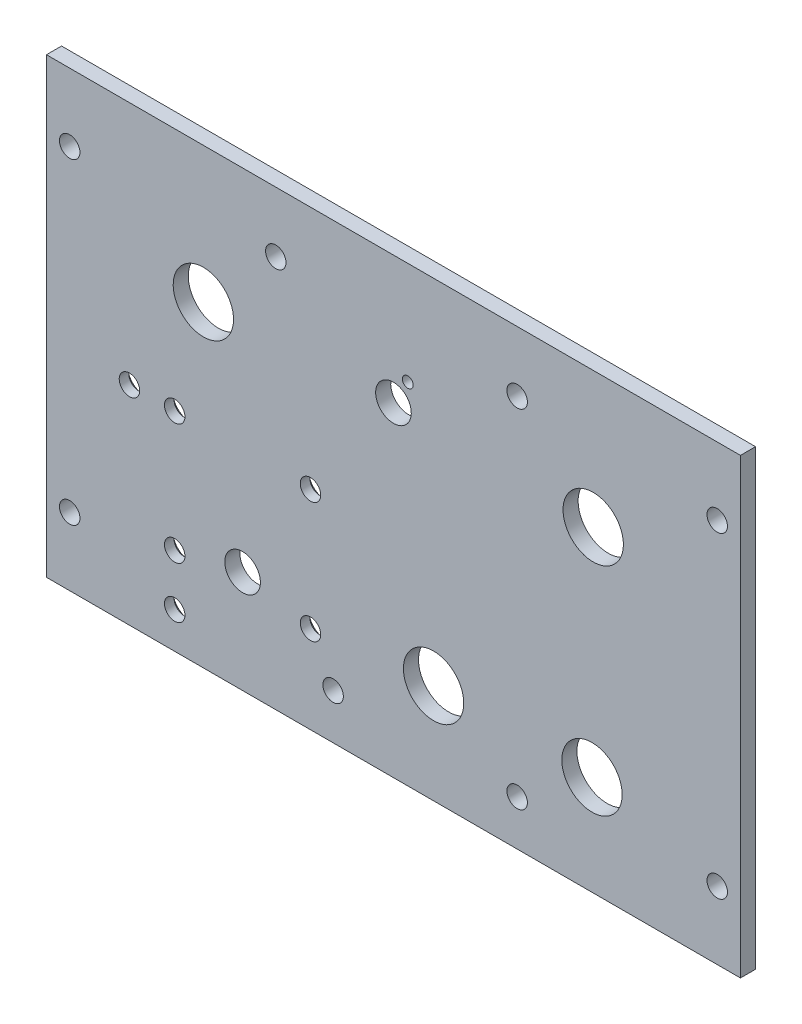
from build123d import *

# Parameters (mm, degrees)
SKETCH1_W                                         = 146.05
SKETCH1_H                                         = 95.25
BOSS_EXTRUDE1_DEPTH                               = 3.175
F_6_CLEARANCE_HOLE1_D                             = 4.3053
SKETCH5_R                                         = 6.35
SKETCH5_R_2                                       = 3.75
CUT_EXTRUDE1_DEPTH                                = 175.524869431
CSK_FOR_6_FLAT_HEAD_MACHINE_SCREW_100_D           = 4.3053
CSK_FOR_6_FLAT_HEAD_MACHINE_SCREW_100_CSINK_D     = 7.0866
CSK_FOR_6_FLAT_HEAD_MACHINE_SCREW_100_CSINK_ANGLE = 100
SKETCH8_R                                         = 1.134488875
CUT_EXTRUDE2_DEPTH                                = 175.39393804


with BuildPart() as part:
    # Sketch1 → Boss-Extrude1 (new body)
    with BuildSketch(Plane.XY):
        with Locations((-73.025, 47.625)):
            Rectangle(SKETCH1_W, SKETCH1_H)
    extrude(amount=-BOSS_EXTRUDE1_DEPTH)

    # #6 Clearance Hole1 (through all)
    with Locations(Plane(origin=(0, 0, -3.175), x_dir=(-1, 0, 0), z_dir=(0, 0, -1))):
        with Locations((4.8895, 80.9625), (141.1605, 80.9625), (141.1605, 14.2875), (4.8895, 14.2875), (46.99, 9.525), (85.725, 9.525), (97.79, 82.55), (46.99, 82.55)):
            Hole(F_6_CLEARANCE_HOLE1_D / 2)

    # Sketch5 → Cut-Extrude1 (cut, through all)
    with BuildSketch(Plane(origin=(0, 0, -7.4676), x_dir=(-1, 0, 0), z_dir=(0, 0, -1))):
        with Locations((30.988, 66.675)):
            Circle(SKETCH5_R)
        with Locations((113.03, 66.675)):
            Circle(SKETCH5_R)
        with Locations((64.5795, 20.955)):
            Circle(SKETCH5_R)
        with Locations((31.242, 20.955)):
            Circle(SKETCH5_R)
        with Locations((73.025, 68.326)):
            Circle(SKETCH5_R_2)
        with Locations((104.775, 21.59)):
            Circle(SKETCH5_R_2)
    extrude(amount=-CUT_EXTRUDE1_DEPTH, mode=Mode.SUBTRACT)

    # CSK for #6 Flat Head Machine Screw (100)1 (through all)
    with Locations(Plane(origin=(0, 0, -3.175), x_dir=(-1, 0, 0), z_dir=(0, 0, -1))):
        with Locations((90.4875, 43.815), (90.4875, 18.415), (119.0625, 7.636172046), (119.0625, 18.415), (119.0625, 43.815), (128.5875, 43.815)):
            CounterSinkHole(CSK_FOR_6_FLAT_HEAD_MACHINE_SCREW_100_D / 2, CSK_FOR_6_FLAT_HEAD_MACHINE_SCREW_100_CSINK_D / 2, counter_sink_angle=CSK_FOR_6_FLAT_HEAD_MACHINE_SCREW_100_CSINK_ANGLE)

    # Sketch8 → Cut-Extrude2 (cut, through all)
    with BuildSketch(Plane.XY):
        with Locations((-70.012401844, 73.606641948)):
            Circle(SKETCH8_R)
    extrude(amount=-CUT_EXTRUDE2_DEPTH, mode=Mode.SUBTRACT)


solid = part.part
